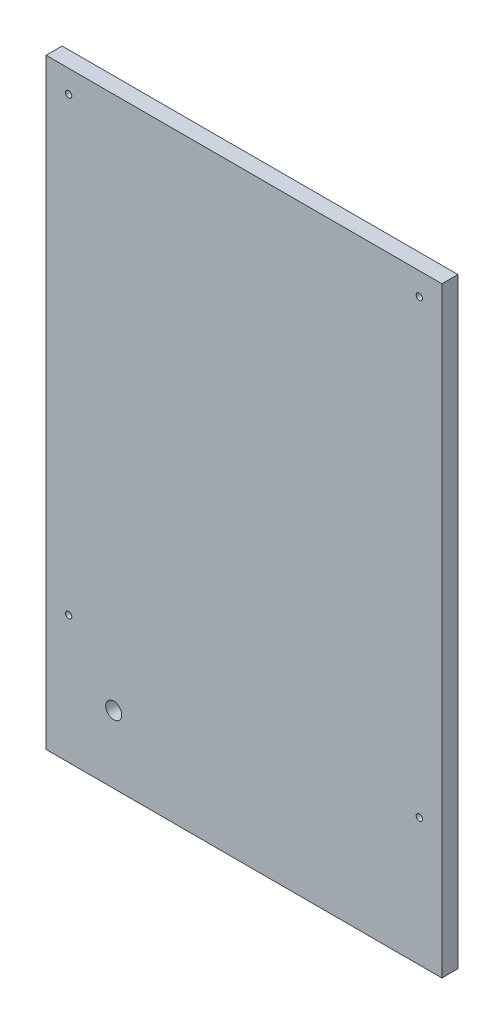
from build123d import *

# Parameters (mm, degrees)
SKETCH1_W            = 395
SKETCH1_H            = 600
BASE_DEPTH           = 16
SKETCH2_R            = 3.15
MOUNTING_HOLES_DEPTH = 719.526965395
TAP_HOLE_REACH       = 720.527
SKETCH4_R            = 8


with BuildPart() as part:
    # Sketch1 → Base (new body)
    with BuildSketch(Plane.XY):
        with Locations((197.5, 300)):
            Rectangle(SKETCH1_W, SKETCH1_H)
    extrude(amount=BASE_DEPTH)

    # Sketch2 → Mounting holes (cut, through all)
    with BuildSketch(Plane.XY.offset(16)):
        with Locations((22.5, 577.5)):
            Circle(SKETCH2_R)
        with Locations((372.5, 577.5)):
            Circle(SKETCH2_R)
        with Locations((22.5, 127.5)):
            Circle(SKETCH2_R)
        with Locations((372.5, 127.5)):
            Circle(SKETCH2_R)
    extrude(amount=-MOUNTING_HOLES_DEPTH, mode=Mode.SUBTRACT)

    # Sketch4 → Tap hole (cut, up to next)
    with BuildSketch(Plane(origin=(0, 0, 0), x_dir=(-1, 0, 0), z_dir=(0, 0, -1)), mode=Mode.PRIVATE) as tap_hole_sk1:
        with Locations((-67.5, 67.5)):
            Circle(SKETCH4_R)
    tap_hole_tool1 = extrude(tap_hole_sk1.sketch, amount=-TAP_HOLE_REACH, mode=Mode.PRIVATE) & part.part
    add(tap_hole_tool1.solids().sort_by_distance((67.5, 67.5, 0))[0], mode=Mode.SUBTRACT)


solid = part.part
